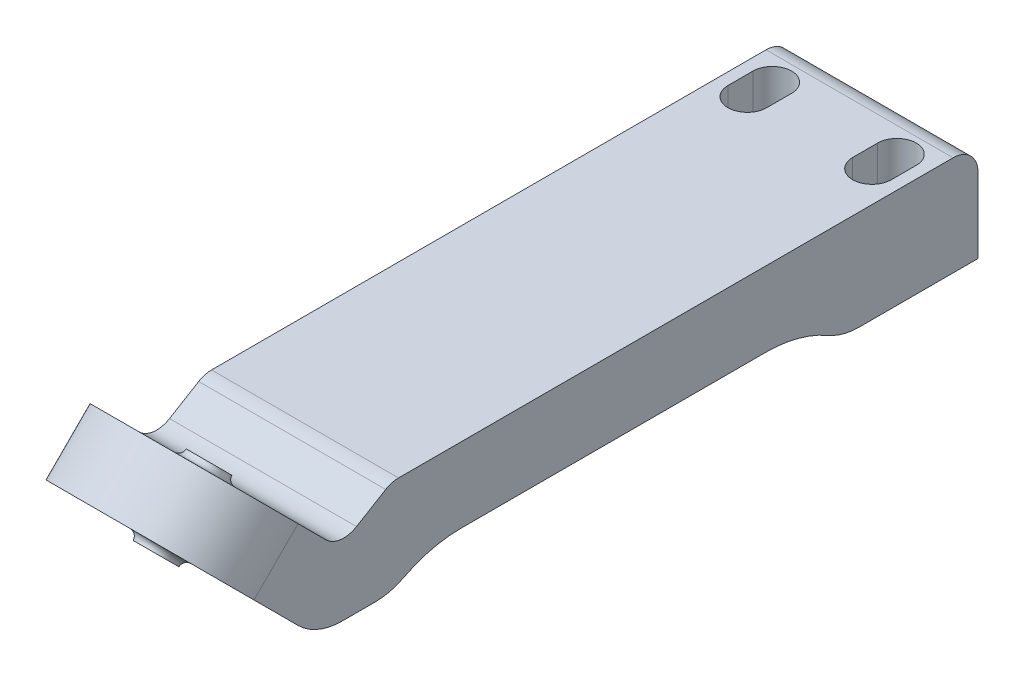
from build123d import *

# Parameters (mm, degrees)
SKETCH_10_W         = 15
SKETCH_10_H         = 8
EXTRUDE_7_DEPTH     = 41
CUT_EXTRUDE_4_DEPTH = 11
SKETCH_12_W         = 15
SKETCH_12_H         = 6
EXTRUDE_8_DEPTH     = 6
SKETCH_14_W         = 15
SKETCH_14_H         = 5
EXTRUDE_9_DEPTH     = 4
EXTRUDE_10_DEPTH    = 15
EXTRUDE_11_DEPTH    = 5
SKETCH_19_R         = 1.1
CUT_EXTRUDE_5_DEPTH = 5
EXTRUDE_START       = 0.5
SKETCH_20_R         = 1.5
SKETCH_20_R_2       = 1.1
EXTRUDE_12_DEPTH    = 0.5
SKETCH_21_R         = 1.5
SKETCH_21_R_2       = 1.1
EXTRUDE_13_DEPTH    = 0.5
FILLET_4_R          = 0.5
CHAMFER_1_SIZE      = 4.493554602
CHAMFER_1_SIZE_2    = 2.7
FILLET_7_R          = 2
SKETCH_23_W         = 15
SKETCH_23_H         = 2
CUT_EXTRUDE_6_DEPTH = 30
FILLET_8_R          = 10
FILLET_9_R          = 5
FILLET_10_R         = 2


# Some blends are built 0.0001 mm under size
with BuildPart() as part:
    # 草图10 → 凸台-拉伸7 (new body)
    with BuildSketch(Plane.XY):
        with Locations((0, 24.68211788)):
            Rectangle(SKETCH_10_W, SKETCH_10_H)
    extrude(amount=EXTRUDE_7_DEPTH)

    # 草图11 → 切除-拉伸4 (cut)
    with BuildSketch(Plane(origin=(0, 28.68211788, 0), x_dir=(1, 0, 0), z_dir=(0, 1, 0))):
        with BuildLine():
            Line((-3.45, -4), (-3.45, -6))
            ThreePointArc((-3.45, -6), (-5, -7.55), (-6.55, -6))
            Line((-6.55, -6), (-6.55, -4))
            ThreePointArc((-6.55, -4), (-5, -2.45), (-3.45, -4))
        make_face()
        with BuildLine():
            Line((3.45, -4), (3.45, -6))
            ThreePointArc((3.45, -6), (5, -7.55), (6.55, -6))
            Line((6.55, -6), (6.55, -4))
            ThreePointArc((6.55, -4), (5, -2.45), (3.45, -4))
        make_face()
    extrude(amount=-CUT_EXTRUDE_4_DEPTH, mode=Mode.SUBTRACT)

    # 草图12 → 凸台-拉伸8 (add)
    with BuildSketch(Plane.XY.offset(41)):
        with Locations((0, 25.68211788)):
            Rectangle(SKETCH_12_W, SKETCH_12_H)
    extrude(amount=EXTRUDE_8_DEPTH)

    # 草图14 → 凸台-拉伸9 (add)
    with BuildSketch(Plane.XY.offset(47)):
        with Locations((0, 23.5)):
            Rectangle(SKETCH_14_W, SKETCH_14_H)
    extrude(amount=EXTRUDE_9_DEPTH)

    # 草图17 → 凸台-拉伸10 (add)
    with BuildSketch(Plane.ZY.offset(7.5)):
        Polygon((51, 26), (54.535533906, 29.535533906), (58.071067812, 26), (53.071067812, 21), (51, 21), align=None)
    extrude(amount=-EXTRUDE_10_DEPTH)

    # 草图18 → 凸台-拉伸11 (add)
    with BuildSketch(Plane(origin=(0, -16.035533906, 16.035533906), x_dir=(1, 0, 0), z_dir=(0, -0.7071067811865507, 0.7071067811865445))):
        with BuildLine():
            Line((7.5, 59.447222151), (-7.5, 59.447222151))
            ThreePointArc((-7.5, 59.447222151), (0, 66.947222151), (7.5, 59.447222151))
        make_face()
    extrude(amount=-EXTRUDE_11_DEPTH)

    # 草图19 → 切除-拉伸5 (cut)
    with BuildSketch(Plane(origin=(0, -16.035533906, 16.035533906), x_dir=(1, 0, 0), z_dir=(0, -0.7071067811865507, 0.7071067811865445))):
        with Locations(Location((0, 59.447222151, 0), (0, 0, 270))):
            Circle(SKETCH_19_R)
    extrude(amount=-CUT_EXTRUDE_5_DEPTH, mode=Mode.SUBTRACT)

    # 草图20 → 凸台-拉伸12 (add)
    with BuildSketch(Plane(origin=(0, -16.035533906, 16.035533906), x_dir=(1, 0, 0), z_dir=(0, -0.7071067811865507, 0.7071067811865445)).offset(EXTRUDE_START)):
        with Locations(Location((0, 59.447222151, 0), (0, 0, 270))):
            Circle(SKETCH_20_R)
        with Locations(Location((0, 59.447222151, 0), (0, 0, 270))):
            Circle(SKETCH_20_R_2, mode=Mode.SUBTRACT)
    extrude(amount=-EXTRUDE_12_DEPTH)

    # 草图21 → 凸台-拉伸13 (add)
    with BuildSketch(Plane(origin=(0, -12.5, 12.5), x_dir=(1, 0, 0), z_dir=(0, 0.7071067811865513, -0.7071067811865437))):
        with Locations(Location((0, -59.447222151, 0), (0, 0, 90))):
            Circle(SKETCH_21_R)
        with Locations(Location((0, -59.447222151, 0), (0, 0, 90))):
            Circle(SKETCH_21_R_2, mode=Mode.SUBTRACT)
    extrude(amount=EXTRUDE_13_DEPTH)

    # 圆角4
    fillet_4_edges = [part.edges().sort_by_distance(p)[0] for p in [
        (0, 27.060660172, 59.131727984),
        (0, 30.596194078, 55.596194078),
    ]]
    fillet(fillet_4_edges, radius=FILLET_4_R - 0.0001)  # a hair under: the kernel refuses the full size

    # 倒角1
    # the kernel refuses this chamfer: 4.493554602, 2.7 mm, written as the material it adds along each edge
    with BuildSketch(Plane(origin=(-7.5, 26, 47), x_dir=(0, -0.019914630580833353, 0.9998016840798123), z_dir=(1, 0, 0))) as chamfer_1_piece_1_section:
        Polygon((CHAMFER_1_SIZE * 0.999801684157, -CHAMFER_1_SIZE * 0.0199146305824), (-CHAMFER_1_SIZE_2 * 0.0199146305808, -CHAMFER_1_SIZE_2 * 0.99980168408), (0, 0), align=None)
    chamfer_1_piece_1 = extrude(amount=15, mode=Mode.PRIVATE)
    chamfer_1_piece_1 = split(chamfer_1_piece_1, bisect_by=Plane(origin=(0, 28.68211788, 48.477199106), z_dir=(0, -1, 0)), keep=Keep.TOP, mode=Mode.PRIVATE)
    add(chamfer_1_piece_1)

    # 圆角7
    fillet_7_edges = [part.edges().sort_by_distance(p)[0] for p in [
        (0, 26.18524881, 51.18524881),
        (0, 28.68211788, 47.029760846),
    ]]
    fillet(fillet_7_edges, radius=FILLET_7_R)

    # 草图23 → 切除-拉伸6 (cut)
    with BuildSketch(Plane.XY.offset(41)):
        with Locations((0, 21.68211788)):
            Rectangle(SKETCH_23_W, SKETCH_23_H)
    extrude(amount=-CUT_EXTRUDE_6_DEPTH, mode=Mode.SUBTRACT)

    # 圆角8
    # the kernel refuses this fillet: 10 mm, written as the material it adds along each edge
    with BuildSketch(Plane(origin=(7.5, 22.68211788, 11), x_dir=(0, -1, 0), z_dir=(-1, 0, 0))) as fillet_8_piece_1:
        with BuildLine():
            CenterArc((10, 6), FILLET_8_R, 180, 36.869897646)
            Line((0, 6), (-0.2, 6))
            Line((-0.2, 6), (-0.2, 0))
            Line((-0.2, 0), (0, -0.2))
            ThreePointArc((0, -0.2), (1, -0.2), (1.84, -0.12))
            Line((1.84, -0.12), (2, 0))
        make_face()
    extrude(amount=15)
    with BuildSketch(Plane(origin=(7.5, 22.68211788, 47), x_dir=(0, 0, -1), z_dir=(-1, 0, 0))) as fillet_8_piece_2:
        with BuildLine():
            CenterArc((5.550931186, 10), FILLET_8_R, 236.282871199, 33.717128801)
            Line((0, 1.68211788), (-0.111018624, 1.515760238))
            ThreePointArc((-0.111018624, 1.515760238), (-0.2, 0.84105894), (-0.2, 0))
            Line((-0.2, 0), (0, -0.2))
            Line((0, -0.2), (5.550931186, -0.2))
            Line((5.550931186, -0.2), (5.550931186, 0))
        make_face()
    extrude(amount=15)

    # 圆角9
    fillet_9_edges = [part.edges().sort_by_distance(p)[0] for p in [
        (0, 20.68211788, 11),
        (0, 21, 47),
        (0, 21, 53.071067812),
    ]]
    fillet(fillet_9_edges, radius=FILLET_9_R)

    # 圆角10
    fillet_10_edges = [part.edges().sort_by_distance(p)[0] for p in [
        (0, 28.68211788, 0),
    ]]
    fillet(fillet_10_edges, radius=FILLET_10_R)


solid = part.part
